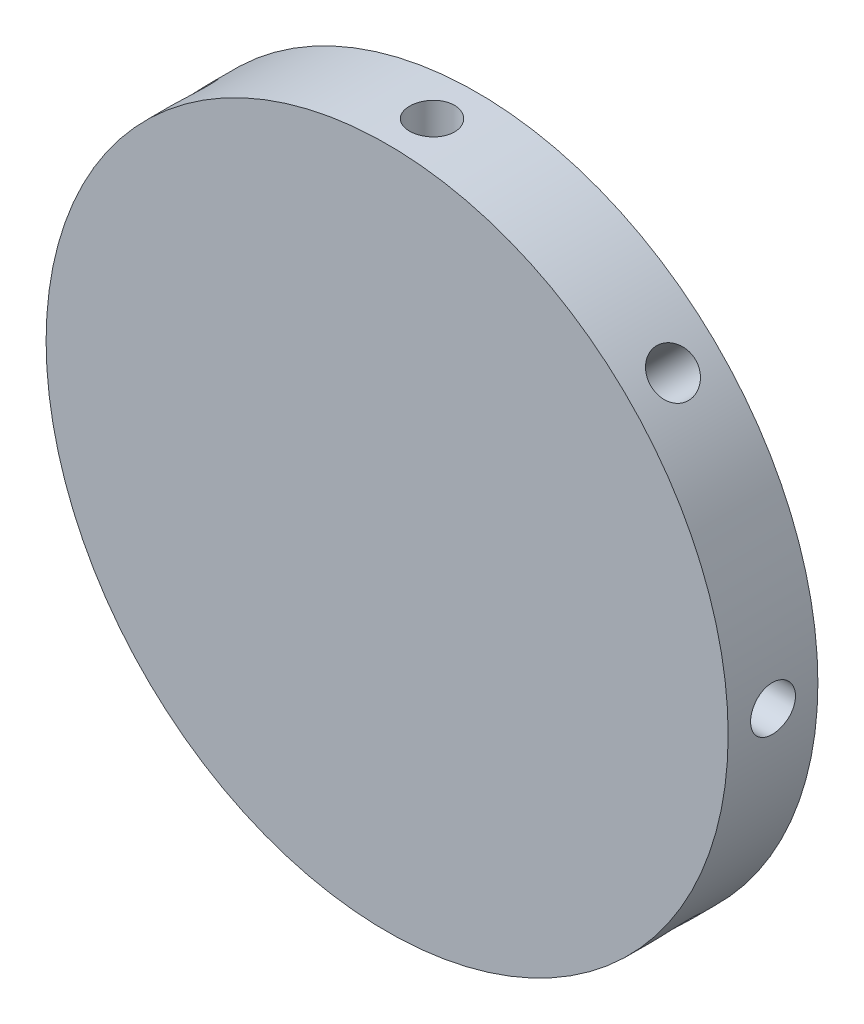
from build123d import *

# Parameters (mm, degrees)
SKETCH1_R           = 38
BOSS_EXTRUDE1_DEPTH = 10
SKETCH2_R           = 2.5
CUT_EXTRUDE1_DEPTH  = 10
CIRPATTERN1_COUNT   = 8


with BuildPart() as part:
    # Sketch1 → Boss-Extrude1 (new body)
    with BuildSketch(Plane.XY):
        Circle(SKETCH1_R)
    extrude(amount=BOSS_EXTRUDE1_DEPTH)

    # Sketch2 → Cut-Extrude1 (cut)
    with BuildSketch(Plane(origin=(0, 38, 0), x_dir=(1, 0, 0), z_dir=(0, 1, 0))):
        with Locations((0, -5)):
            Circle(SKETCH2_R)
    cut_extrude1 = extrude(amount=-CUT_EXTRUDE1_DEPTH, mode=Mode.SUBTRACT)

    # CirPattern1: Cut-Extrude1 ×8 about axis
    cirpattern1_axis = Axis((0, 0, 10), (0, 0, -1))
    for i in range(1, CIRPATTERN1_COUNT):
        add(cut_extrude1.rotate(cirpattern1_axis, i * 360 / CIRPATTERN1_COUNT), mode=Mode.SUBTRACT)


solid = part.part
